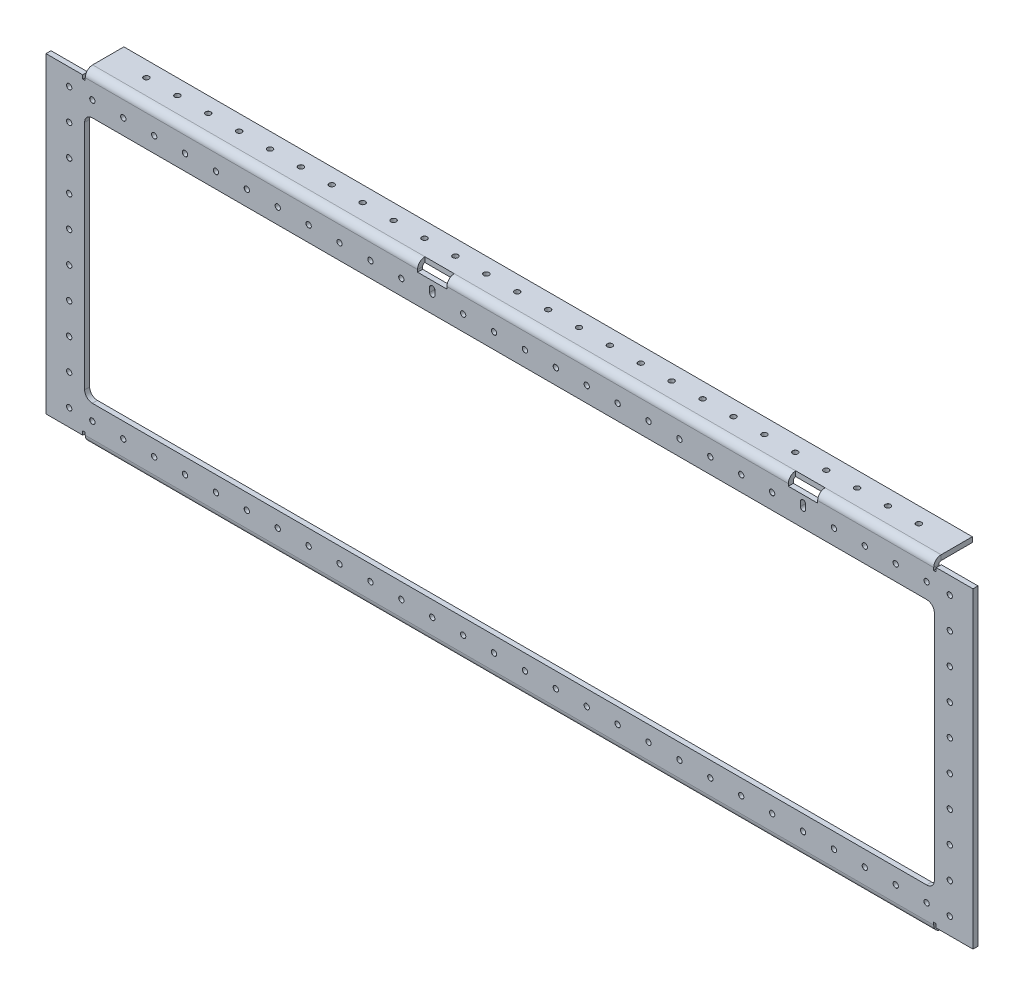
from build123d import *

# Parameters (mm, degrees)
SKETCH1_W                       = 600
SKETCH1_H                       = 210
BASE_FLANGE1_DEPTH              = 3.2639
SKETCH6_W                       = 25.4
SKETCH6_H                       = 4
CUT_EXTRUDE1_DEPTH              = 10
EDGE_FLANGE1_STRIP_W            = 16.1036
EDGE_FLANGE1_STRIP_H            = 3.2639
EDGE_FLANGE1_STRIP_CUT_DEPTH    = 549.2
EDGE_FLANGE1_RELIEF_W           = 17.73555
EDGE_FLANGE1_RELIEF_H           = 1.63195
EDGE_FLANGE1_RELIEF_CUT_DEPTH   = 3.2639
EDGE_FLANGE1_STRIP_2_W          = 16.1036
EDGE_FLANGE1_STRIP_2_H          = 3.2639
EDGE_FLANGE1_STRIP_CUT_2_DEPTH  = 549.2
EDGE_FLANGE1_RELIEF_2_W         = 17.73555
EDGE_FLANGE1_RELIEF_2_H         = 1.63195
EDGE_FLANGE1_RELIEF_CUT_2_DEPTH = 3.2639
EDGE_FLANGE1_DEPTH              = 549.2
EDGE_FLANGE1_BEND_DEPTH         = 549.2
SKETCH15_W                      = 550
SKETCH15_H                      = 160
CUT_EXTRUDE2_DEPTH              = 10
FILLET1_R                       = 5
CUT_EXTRUDE6_START              = -26
CUT_EXTRUDE6_OUTLINE_W          = 19
CUT_EXTRUDE6_OUTLINE_H          = 6.2639
CUT_EXTRUDE6_DEPTH              = 5.7879
M3_CLEARANCE_HOLE1_D            = 3.4
M3_CLEARANCE_HOLE1_CSINK_D      = 3.45
M3_CLEARANCE_HOLE1_CSINK_ANGLE  = 90
M3_CLEARANCE_HOLE2_D            = 3.4
M3_CLEARANCE_HOLE2_CSINK_D      = 3.45
M3_CLEARANCE_HOLE2_CSINK_ANGLE  = 90
M3_CLEARANCE_HOLE3_D            = 3.4
M3_CLEARANCE_HOLE3_CSINK_D      = 3.45
M3_CLEARANCE_HOLE3_CSINK_ANGLE  = 90
M3_START                        = -4
M3_CLEARANCE_SLOT1_DEPTH        = 5


with BuildPart() as part:
    # Base-Flange1: sheet metal written as solids
    # Sketch1 → Base-Flange1 (new body)
    with BuildSketch(Plane.XY):
        Rectangle(SKETCH1_W, SKETCH1_H)
    extrude(amount=-BASE_FLANGE1_DEPTH)

    # Sketch6 → Cut-Extrude1 (cut)
    with BuildSketch(Plane.XY):
        with Locations((-287.3, 103)):
            Rectangle(SKETCH6_W, SKETCH6_H)
        with Locations((-287.3, -103)):
            Rectangle(SKETCH6_W, SKETCH6_H)
        with Locations((287.3, -103)):
            Rectangle(SKETCH6_W, SKETCH6_H)
        with Locations((287.3, 103)):
            Rectangle(SKETCH6_W, SKETCH6_H)
    extrude(amount=-CUT_EXTRUDE1_DEPTH, mode=Mode.SUBTRACT)

    # Edge-Flange1: sheet metal written as solids
    # Edge-Flange1 strip (on a plane across the edge) → Edge-Flange1 strip cut (cut)
    with BuildSketch(Plane(origin=(-274.6, 105, -3.2639), x_dir=(0, -1, 0), z_dir=(1, 0, 0))):
        with Locations((-3.2639, -1.63195)):
            Rectangle(EDGE_FLANGE1_STRIP_W, EDGE_FLANGE1_STRIP_H)
    extrude(amount=EDGE_FLANGE1_STRIP_CUT_DEPTH, mode=Mode.SUBTRACT)

    # Edge-Flange1 relief (on the sheet) → Edge-Flange1 relief cut (cut)
    with BuildSketch(Plane(origin=(-274.6, 100.2121, -3.2639), x_dir=(0, -1, 0), z_dir=(0, 0, -1))):
        with Locations((-7.235825, 0.815975)):
            Rectangle(EDGE_FLANGE1_RELIEF_W, EDGE_FLANGE1_RELIEF_H)
        with Locations((-7.235825, -550.015975)):
            Rectangle(EDGE_FLANGE1_RELIEF_W, EDGE_FLANGE1_RELIEF_H)
    extrude(amount=-EDGE_FLANGE1_RELIEF_CUT_DEPTH, mode=Mode.SUBTRACT)

    # Edge-Flange1 strip 2 (on a plane across the edge) → Edge-Flange1 strip cut 2 (cut)
    with BuildSketch(Plane(origin=(274.6, -105, -3.2639), x_dir=(0, 1, 0), z_dir=(-1, 0, 0))):
        with Locations((-3.2639, -1.63195)):
            Rectangle(EDGE_FLANGE1_STRIP_2_W, EDGE_FLANGE1_STRIP_2_H)
    extrude(amount=EDGE_FLANGE1_STRIP_CUT_2_DEPTH, mode=Mode.SUBTRACT)

    # Edge-Flange1 relief 2 (on the sheet) → Edge-Flange1 relief cut 2 (cut)
    with BuildSketch(Plane(origin=(274.6, -100.2121, -3.2639), x_dir=(0, 1, 0), z_dir=(0, 0, -1))):
        with Locations((-7.235825, 0.815975)):
            Rectangle(EDGE_FLANGE1_RELIEF_2_W, EDGE_FLANGE1_RELIEF_2_H)
        with Locations((-7.235825, -550.015975)):
            Rectangle(EDGE_FLANGE1_RELIEF_2_W, EDGE_FLANGE1_RELIEF_2_H)
    extrude(amount=-EDGE_FLANGE1_RELIEF_CUT_2_DEPTH, mode=Mode.SUBTRACT)

    # Edge-Flange1 section (on a plane across the edge) → Edge-Flange1 (add)
    with BuildSketch(Plane(origin=(-274.6, 105, -3.2639), x_dir=(0, -1, 0), z_dir=(1, 0, 0))):
        with BuildLine():
            Line((0, 1.524), (0, 21.7361))
            Line((0, 21.7361), (3.2639, 21.7361))
            Line((3.2639, 21.7361), (3.2639, 1.524))
            ThreePointArc((3.2639, 1.524), (3.710269265, 0.446369265), (4.7879, 0))
            Line((4.7879, 0), (4.7879, -3.2639))
            ThreePointArc((4.7879, -3.2639), (1.402343442, -1.861556558), (0, 1.524))
        make_face()
    extrude(amount=EDGE_FLANGE1_DEPTH)

    # Edge-Flange1 section 2 (on a plane across the edge) → Edge-Flange1 bend (add)
    with BuildSketch(Plane(origin=(274.6, -105, -3.2639), x_dir=(0, 1, 0), z_dir=(-1, 0, 0))):
        with BuildLine():
            Line((0, 1.524), (0, 21.7361))
            Line((0, 21.7361), (3.2639, 21.7361))
            Line((3.2639, 21.7361), (3.2639, 1.524))
            ThreePointArc((3.2639, 1.524), (3.710269265, 0.446369265), (4.7879, 0))
            Line((4.7879, 0), (4.7879, -3.2639))
            ThreePointArc((4.7879, -3.2639), (1.402343442, -1.861556558), (0, 1.524))
        make_face()
    extrude(amount=EDGE_FLANGE1_BEND_DEPTH)

    # Sketch15 → Cut-Extrude2 (cut)
    with BuildSketch(Plane.XY):
        Rectangle(SKETCH15_W, SKETCH15_H)
    extrude(amount=-CUT_EXTRUDE2_DEPTH, mode=Mode.SUBTRACT)

    # Fillet1
    fillet1_edges = [part.edges().sort_by_distance(p)[0] for p in [
        (275, 80, -1.63195),
        (275, -80, -1.63195),
        (-275, -80, -1.63195),
        (-275, 80, -1.63195),
    ]]
    fillet(fillet1_edges, radius=FILLET1_R)

    # Cut-Extrude6: read off the stored shape, not the designer's step
    # Cut-Extrude6 outline → Cut-Extrude6 (cut)
    with BuildSketch(Plane(origin=(0, 0, -25), x_dir=(-1, 0, 0), z_dir=(0, 0, -1)).offset(CUT_EXTRUDE6_START)):
        with Locations((-190, 101.86805)):
            Rectangle(CUT_EXTRUDE6_OUTLINE_W, CUT_EXTRUDE6_OUTLINE_H)
        with Locations((50, 101.86805)):
            Rectangle(CUT_EXTRUDE6_OUTLINE_W, CUT_EXTRUDE6_OUTLINE_H)
    extrude(amount=CUT_EXTRUDE6_DEPTH, mode=Mode.SUBTRACT)

    # M3 Clearance Hole1 (through all)
    with Locations(Plane(origin=(0, 105, 0), x_dir=(1, 0, 0), z_dir=(0, 1, 0))):
        with Locations((-250, 15), (10, 15), (30, 15), (50, 15), (70, 15), (90, 15), (110, 15), (130, 15), (150, 15), (170, 15), (190, 15), (210, 15), (230, 15), (250, 15), (-10, 15), (-30, 15), (-50, 15), (-70, 15), (-90, 15), (-110, 15), (-130, 15), (-150, 15), (-170, 15), (-190, 15), (-210, 15), (-230, 15)):
            CounterSinkHole(M3_CLEARANCE_HOLE1_D / 2, M3_CLEARANCE_HOLE1_CSINK_D / 2, counter_sink_angle=M3_CLEARANCE_HOLE1_CSINK_ANGLE)

    # M3 Clearance Hole2 (through all)
    with Locations(Plane.XY):
        with Locations((285, 90), (-285, -10), (-285, 10), (-285, 30), (-285, -30), (-285, -50), (-285, -70), (-285, -90), (-285, 50), (-285, 70), (-285, 90), (285, -90), (285, -50), (285, -70), (285, -30), (285, -10), (285, 10), (285, 30), (285, 50), (285, 70)):
            CounterSinkHole(M3_CLEARANCE_HOLE2_D / 2, M3_CLEARANCE_HOLE2_CSINK_D / 2, counter_sink_angle=M3_CLEARANCE_HOLE2_CSINK_ANGLE)

    # M3 Clearance Hole3 (through all)
    with Locations(Plane.XY):
        with Locations((-270, -90), (-10, 90), (30, 90), (-30, 90), (-70, 90), (-90, 90), (-110, 90), (-130, 90), (-150, 90), (-170, 90), (-190, 90), (-210, 90), (-230, 90), (-250, 90), (-270, 90), (10, 90), (50, 90), (70, 90), (90, 90), (110, 90), (130, 90), (150, 90), (170, 90), (210, 90), (230, 90), (250, 90), (270, 90), (270, -90), (250, -90), (230, -90), (210, -90), (190, -90), (170, -90), (150, -90), (130, -90), (110, -90), (90, -90), (70, -90), (50, -90), (30, -90), (10, -90), (-10, -90), (-30, -90), (-50, -90), (-70, -90), (-90, -90), (-110, -90), (-130, -90), (-150, -90), (-170, -90), (-190, -90), (-210, -90), (-230, -90), (-250, -90)):
            CounterSinkHole(M3_CLEARANCE_HOLE3_D / 2, M3_CLEARANCE_HOLE3_CSINK_D / 2, counter_sink_angle=M3_CLEARANCE_HOLE3_CSINK_ANGLE)

    # M3 Clearance Slot1: read off the stored shape, not the designer's step
    # M3 Clearance Slot1 outline → M3 Clearance Slot1 (cut)
    with BuildSketch(Plane.XY.offset(M3_START)):
        with BuildLine():
            Line((191.7, 91.2361), (191.7, 94.2361))
            ThreePointArc((191.7, 94.2361), (190, 95.9361), (188.3, 94.2361))
            Line((188.3, 94.2361), (188.3, 91.2361))
            ThreePointArc((188.3, 91.2361), (190, 89.5361), (191.7, 91.2361))
        make_face()
        with BuildLine():
            Line((-48.3, 91.2361), (-48.3, 94.2361))
            ThreePointArc((-48.3, 94.2361), (-50, 95.9361), (-51.7, 94.2361))
            Line((-51.7, 94.2361), (-51.7, 91.2361))
            ThreePointArc((-51.7, 91.2361), (-50, 89.5361), (-48.3, 91.2361))
        make_face()
    extrude(amount=M3_CLEARANCE_SLOT1_DEPTH, mode=Mode.SUBTRACT)

    # M3 Clearance Slot1 2: loft between two sections, ruled curve by curve
    m3_clearance_slot1_2_from = [
        Edge.make_three_point_arc((191.7, 94.2361, -0.025), (191.202081528, 95.438181528, -0.025), (190, 95.9361, -0.025)),
        Edge.make_three_point_arc((190, 95.9361, -0.025), (188.797918472, 95.438181528, -0.025), (188.3, 94.2361, -0.025)),
        Edge.make_three_point_arc((188.3, 91.2361, -0.025), (188.797918472, 90.034018472, -0.025), (190, 89.5361, -0.025)),
        Edge.make_three_point_arc((190, 89.5361, -0.025), (191.202081528, 90.034018472, -0.025), (191.7, 91.2361, -0.025)),
        Edge.make_line((188.3, 94.2361, -0.025), (188.3, 91.2361, -0.025)),
        Edge.make_line((191.7, 94.2361, -0.025), (191.7, 91.2361, -0.025)),
    ]
    m3_clearance_slot1_2_to = [
        Edge.make_three_point_arc((191.725, 94.2361, 0), (191.219759198, 95.455859198, 0), (190, 95.9611, 0)),
        Edge.make_three_point_arc((190, 95.9611, 0), (188.780240802, 95.455859198, 0), (188.275, 94.2361, 0)),
        Edge.make_three_point_arc((188.275, 91.2361, 0), (188.780240802, 90.016340802, 0), (190, 89.5111, 0)),
        Edge.make_three_point_arc((190, 89.5111, 0), (191.219759198, 90.016340802, 0), (191.725, 91.2361, 0)),
        Edge.make_line((188.275, 94.2361, 0), (188.275, 91.2361, 0)),
        Edge.make_line((191.725, 94.2361, 0), (191.725, 91.2361, 0)),
    ]
    m3_clearance_slot1_2 = Solid(Shell([*[Face.make_surface_from_curves(m3_clearance_slot1_2_from[k], m3_clearance_slot1_2_to[k]) for k in range(6)], Face(Wire(m3_clearance_slot1_2_from)), Face(Wire(m3_clearance_slot1_2_to))]))
    add(m3_clearance_slot1_2, mode=Mode.SUBTRACT)

    # M3 Clearance Slot1 3: loft between two sections, ruled curve by curve
    m3_clearance_slot1_3_from = [
        Edge.make_three_point_arc((-48.3, 94.2361, -0.025), (-48.797918472, 95.438181528, -0.025), (-50, 95.9361, -0.025)),
        Edge.make_three_point_arc((-50, 95.9361, -0.025), (-51.202081528, 95.438181528, -0.025), (-51.7, 94.2361, -0.025)),
        Edge.make_three_point_arc((-51.7, 91.2361, -0.025), (-51.202081528, 90.034018472, -0.025), (-50, 89.5361, -0.025)),
        Edge.make_three_point_arc((-50, 89.5361, -0.025), (-48.797918472, 90.034018472, -0.025), (-48.3, 91.2361, -0.025)),
        Edge.make_line((-51.7, 94.2361, -0.025), (-51.7, 91.2361, -0.025)),
        Edge.make_line((-48.3, 94.2361, -0.025), (-48.3, 91.2361, -0.025)),
    ]
    m3_clearance_slot1_3_to = [
        Edge.make_three_point_arc((-48.275, 94.2361, 0), (-48.780240802, 95.455859198, 0), (-50, 95.9611, 0)),
        Edge.make_three_point_arc((-50, 95.9611, 0), (-51.219759198, 95.455859198, 0), (-51.725, 94.2361, 0)),
        Edge.make_three_point_arc((-51.725, 91.2361, 0), (-51.219759198, 90.016340802, 0), (-50, 89.5111, 0)),
        Edge.make_three_point_arc((-50, 89.5111, 0), (-48.780240802, 90.016340802, 0), (-48.275, 91.2361, 0)),
        Edge.make_line((-51.725, 94.2361, 0), (-51.725, 91.2361, 0)),
        Edge.make_line((-48.275, 94.2361, 0), (-48.275, 91.2361, 0)),
    ]
    m3_clearance_slot1_3 = Solid(Shell([*[Face.make_surface_from_curves(m3_clearance_slot1_3_from[k], m3_clearance_slot1_3_to[k]) for k in range(6)], Face(Wire(m3_clearance_slot1_3_from)), Face(Wire(m3_clearance_slot1_3_to))]))
    add(m3_clearance_slot1_3, mode=Mode.SUBTRACT)


solid = part.part
